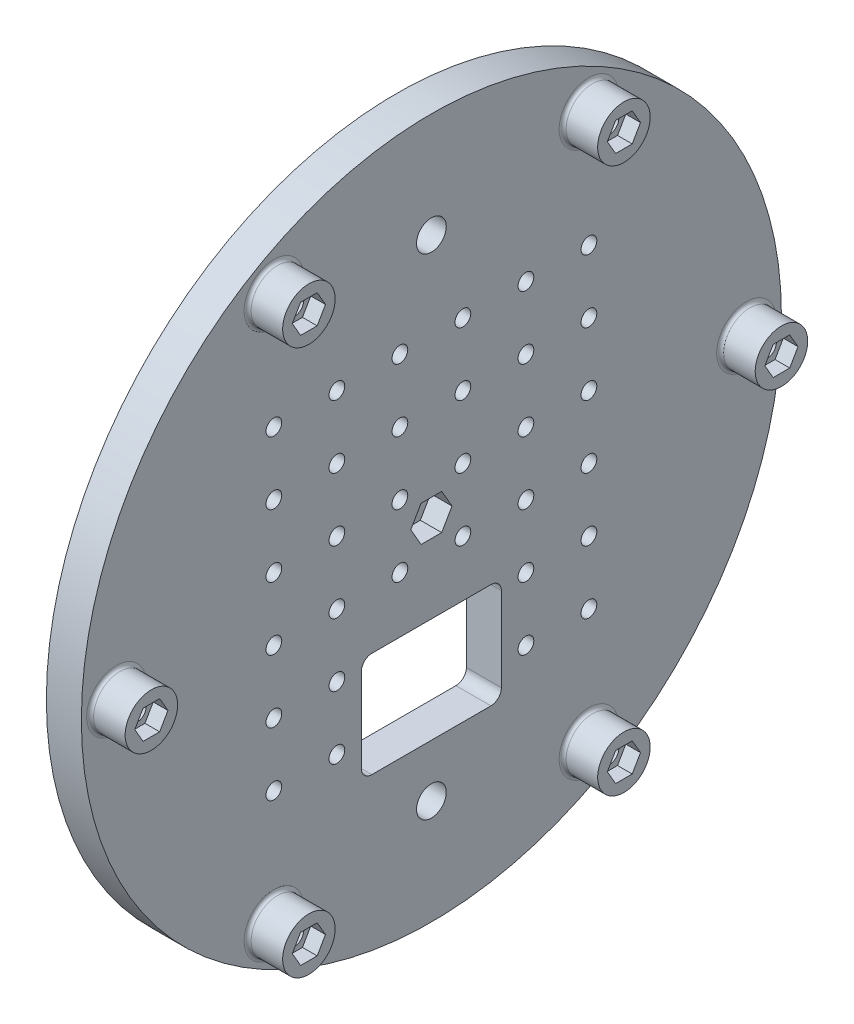
from build123d import *

# Parameters (mm, degrees)
SKETCH_1_R                       = 100
EXTRUDE_1_DEPTH                  = 10
SKETCH_2_R                       = 4.25
CUT_EXTRUDE_560_DEPTH            = 142.774468788
CUT_EXTRUDE_M6_DEPTH             = 6.1
CUT_EXTRUDE_M6_2_REACH           = 143.553
SKETCH_15_R                      = 3.15
CUT_EXTRUDE_3_REACH              = 143.774
SKETCH_17_R                      = 2.25
PATTERN_LINEAR_1_COUNT           = 6
PATTERN_LINEAR_1_PITCH           = 18
PATTERN_LINEAR_1_COUNT_DIR2      = 6
PATTERN_LINEAR_1_PITCH_DIR2      = 18
CUT_EXTRUDE_6901_REACH           = 143.774
WRAP_START                       = -0.3
WRAP_1_DEPTH                     = 0.3
SKETCH_25_R                      = 7.5
SKETCH_25_R_2                    = 2.75
EXTRUDE_3_DEPTH                  = 10
CUT_EXTRUDE_7_REACH              = 144.829
SKETCH_26_R                      = 2.75
FILLET_5_R                       = 1
CUT_EXTRUDE_8_DEPTH              = 4.2
PATTERN_CIRCULAR_3_COUNT         = 6
FILLET_5_OF_PATTERN_CIRCULAR_3_R = 1


# Read off the part's stored shape, not the designer's step: 包覆1
with BuildPart() as part:
    # 草圖1 → 填料-伸長1 (new body)
    with BuildSketch(Plane(origin=(0, 0, 0), x_dir=(0, 0, -1), z_dir=(1, 0, 0))):
        Circle(SKETCH_1_R)
    extrude(amount=EXTRUDE_1_DEPTH)

    # 草圖2 → Cut-Extrude 560 (cut, through all)
    with BuildSketch(Plane(origin=(10, 0, 0), x_dir=(0, 0, -1), z_dir=(1, 0, 0))):
        with Locations((0, 70)):
            Circle(SKETCH_2_R)
        with Locations(Location((0, -70, 0), (0, 0, 180))):
            Circle(SKETCH_2_R)
    extrude(amount=-CUT_EXTRUDE_560_DEPTH, mode=Mode.SUBTRACT)

    # 草圖14 → Cut-Extrude M6 (cut)
    with BuildSketch(Plane(origin=(10, 0, 0), x_dir=(0, 0, -1), z_dir=(1, 0, 0))):
        Polygon((5.888972746, 0), (2.944486373, 5.1), (-2.944486373, 5.1), (-5.888972746, 0), (-2.944486373, -5.1), (2.944486373, -5.1), align=None)
    extrude(amount=-CUT_EXTRUDE_M6_DEPTH, mode=Mode.SUBTRACT)

    # 草圖15 → Cut-Extrude M6 2 (cut, up to next)
    with BuildSketch(Plane(origin=(3.9, 0, 0), x_dir=(0, 0, -1), z_dir=(1, 0, 0)), mode=Mode.PRIVATE) as cut_extrude_m6_2_sk1:
        Circle(SKETCH_15_R)
    cut_extrude_m6_2_tool1 = extrude(cut_extrude_m6_2_sk1.sketch, amount=-CUT_EXTRUDE_M6_2_REACH, mode=Mode.PRIVATE) & part.part
    add(cut_extrude_m6_2_tool1.solids().sort_by_distance((3.9, 0, 0))[0], mode=Mode.SUBTRACT)

    # 草圖17 → 除料-伸長3 (cut, up to next)
    with BuildSketch(Plane(origin=(10, 0, 0), x_dir=(0, 0, -1), z_dir=(1, 0, 0)), mode=Mode.PRIVATE) as cut_extrude_3_sk1:
        with Locations((-45, 45)):
            Circle(SKETCH_17_R)
    cut_extrude_3_tool1 = extrude(cut_extrude_3_sk1.sketch, amount=-CUT_EXTRUDE_3_REACH, mode=Mode.PRIVATE) & part.part
    cut_extrude_3 = cut_extrude_3_tool1.solids().sort_by_distance((10, 45, 45))[0]
    add(cut_extrude_3, mode=Mode.SUBTRACT)

    # 直線複製排列1: Cut-Extrude 3 6 × 6, 4 skipped
    with Locations(*[(0, -i * PATTERN_LINEAR_1_PITCH, -j * PATTERN_LINEAR_1_PITCH_DIR2) for i in range(PATTERN_LINEAR_1_COUNT) for j in range(PATTERN_LINEAR_1_COUNT_DIR2) if (i, j) not in ((0, 0), (4, 2), (4, 3), (5, 2), (5, 3))]):
        add(cut_extrude_3, mode=Mode.SUBTRACT)

    # 草圖16 → Cut-Extrude 6901 (cut, up to next)
    with BuildSketch(Plane(origin=(10, 0, 0), x_dir=(0, 0, -1), z_dir=(1, 0, 0)), mode=Mode.PRIVATE) as cut_extrude_6901_sk1:
        with BuildLine():
            Line((-17, -25), (17, -25))
            ThreePointArc((17, -25), (19.121320344, -25.878679656), (20, -28))
            Line((20, -28), (20, -52))
            ThreePointArc((20, -52), (19.121320344, -54.121320344), (17, -55))
            Line((17, -55), (-17, -55))
            ThreePointArc((-17, -55), (-19.121320344, -54.121320344), (-20, -52))
            Line((-20, -52), (-20, -28))
            ThreePointArc((-20, -28), (-19.121320344, -25.878679656), (-17, -25))
        make_face()
    cut_extrude_6901_tool1 = extrude(cut_extrude_6901_sk1.sketch, amount=-CUT_EXTRUDE_6901_REACH, mode=Mode.PRIVATE) & part.part
    add(cut_extrude_6901_tool1.solids().sort_by_distance((10, -40, 0))[0], mode=Mode.SUBTRACT)

    # 包覆1 outline → 包覆1 (cut)
    # profile 1 of 5: a face of its own
    with BuildSketch(Plane.ZY.offset(WRAP_START)):
        with BuildLine():
            add(Edge.make_bspline(
                [(2.978342498, -64.338842147), (2.956105903, -64.378285479), (2.912842294, -64.455026582), (2.838441546, -64.560458442), (2.760449474, -64.655306158), (2.675345506, -64.737035812), (2.585675827, -64.808287197), (2.490943172, -64.870625022), (2.390654354, -64.923743542), (2.284804629, -64.96849607), (2.172505078, -65.002905564), (2.053483562, -65.027209785), (1.927512066, -65.042233054), (1.841165887, -65.043978194), (1.796952273, -65.044871795)],
                knots=[0, 0, 0, 0, 0.093369857, 0.181660766, 0.265874227, 0.346354784, 0.424599862, 0.501903184, 0.579992091, 0.658443431, 0.738672236, 0.821894148, 0.908800792, 1, 1, 1, 1], degree=3))
            Line((2.978342498, -64.338842147), (2.699296023, -64.192307692))
            add(Edge.make_bspline(
                [(1.757689453, -64.730769231), (1.789040601, -64.730161174), (1.851247291, -64.728954673), (1.943888149, -64.717222762), (2.035027676, -64.698252487), (2.124288659, -64.672362496), (2.209859505, -64.640785644), (2.289105055, -64.602682787), (2.361985271, -64.56053304), (2.430102238, -64.512323365), (2.496173231, -64.453315178), (2.561715717, -64.379679457), (2.631992371, -64.292591929), (2.675981964, -64.227046263), (2.699296023, -64.192307692)],
                knots=[0, 0, 0, 0, 0.082592263, 0.163878894, 0.24565874, 0.327725695, 0.408609961, 0.485749086, 0.559169056, 0.630268476, 0.705306028, 0.792064966, 0.889796437, 1, 1, 1, 1], degree=3))
            add(Edge.make_bspline(
                [(0.824496344, -63.788461538), (0.82603595, -63.822162003), (0.829063524, -63.888432606), (0.843178667, -63.98540339), (0.865427441, -64.077776732), (0.896696504, -64.164859774), (0.934563349, -64.247789901), (0.980949066, -64.325951938), (1.03628862, -64.398989868), (1.098014319, -64.467557006), (1.166721415, -64.528617767), (1.239004162, -64.583269543), (1.315897727, -64.62907514), (1.39679581, -64.66625503), (1.481567595, -64.695361346), (1.570239791, -64.715229166), (1.662637907, -64.728536273), (1.725623641, -64.730015939), (1.757689453, -64.730769231)],
                knots=[0, 0, 0, 0, 0.068384615, 0.134475588, 0.198391058, 0.260753477, 0.321829223, 0.383037238, 0.444653123, 0.507398011, 0.569825238, 0.630777641, 0.690928687, 0.750945133, 0.811049477, 0.872330853, 0.935004094, 1, 1, 1, 1], degree=3))
            Line((0.824496344, -63.788461538), (3.112957882, -63.788461538))
            add(Edge.make_bspline(
                [(2.83461253, -62.900841346), (2.856739468, -62.931044928), (2.900846061, -62.991251046), (2.956093161, -63.089422203), (3.004050556, -63.192132798), (3.042383517, -63.301043095), (3.073423018, -63.414862675), (3.095879837, -63.53440522), (3.109049456, -63.659635131), (3.111638153, -63.744961686), (3.112957882, -63.788461538)],
                knots=[0, 0, 0, 0, 0.11852184, 0.236254763, 0.356174434, 0.477249655, 0.601539871, 0.729618382, 0.862158266, 1, 1, 1, 1], degree=3))
            add(Edge.make_bspline(
                [(1.804664613, -62.397435897), (1.857112218, -62.398789946), (1.960002464, -62.401446282), (2.110034585, -62.426072615), (2.251995302, -62.46512517), (2.385827806, -62.52027896), (2.511545667, -62.591438512), (2.628331717, -62.679580353), (2.738183229, -62.781998441), (2.802091808, -62.86076165), (2.83461253, -62.900841346)],
                knots=[0, 0, 0, 0, 0.132040234, 0.259032841, 0.381879824, 0.502258444, 0.62275219, 0.744742632, 0.870108927, 1, 1, 1, 1], degree=3))
            add(Edge.make_bspline(
                [(0.804864934, -62.874198718), (0.836572616, -62.836329848), (0.898983563, -62.761791697), (1.004539918, -62.663853372), (1.118840115, -62.581809596), (1.240451741, -62.51380246), (1.370788215, -62.462128813), (1.508097506, -62.423621231), (1.653943092, -62.40204322), (1.753648313, -62.398995386), (1.804664613, -62.397435897)],
                knots=[0, 0, 0, 0, 0.128835254, 0.253589335, 0.374643257, 0.495340042, 0.616324775, 0.739759335, 0.86684232, 1, 1, 1, 1], degree=3))
            add(Edge.make_bspline(
                [(0.51039378, -63.728165064), (0.511452921, -63.688870234), (0.513551999, -63.610993069), (0.526782787, -63.495727524), (0.55023108, -63.383699072), (0.582407404, -63.274814624), (0.62395865, -63.16925649), (0.674790869, -63.066960426), (0.734983247, -62.968035287), (0.781455921, -62.905632153), (0.804864934, -62.874198718)],
                knots=[0, 0, 0, 0, 0.128044808, 0.2537679, 0.377428427, 0.500550841, 0.623295883, 0.746578332, 0.872347541, 1, 1, 1, 1], degree=3))
            add(Edge.make_bspline(
                [(1.796952273, -65.044871795), (1.747810296, -65.04372462), (1.651948534, -65.041486813), (1.512408787, -65.022194348), (1.381029369, -64.99072199), (1.257817665, -64.946756448), (1.143075413, -64.889329124), (1.036574558, -64.819369642), (0.937755032, -64.737237388), (0.849730823, -64.642220944), (0.77048694, -64.540538987), (0.70056112, -64.434583102), (0.642103689, -64.324619878), (0.594551079, -64.211349354), (0.556146214, -64.09548546), (0.52937951, -63.975973993), (0.513949762, -63.853138408), (0.511585317, -63.770041073), (0.51039378, -63.728165064)],
                knots=[0, 0, 0, 0, 0.071578658, 0.139629225, 0.204796697, 0.268134963, 0.329813747, 0.391301398, 0.453433515, 0.51655169, 0.579631271, 0.641118921, 0.701294047, 0.760810336, 0.819931722, 0.878919575, 0.938982822, 1, 1, 1, 1], degree=3))
        make_face()
        with BuildLine():
            add(Edge.make_bspline(
                [(1.820790414, -62.711538462), (1.789440976, -62.712150133), (1.727469727, -62.713359279), (1.636168659, -62.724829408), (1.54848896, -62.743789253), (1.463783672, -62.76975421), (1.383162804, -62.804362812), (1.304968036, -62.844946039), (1.231187639, -62.894487623), (1.185046344, -62.932246478), (1.161735927, -62.951322115)],
                knots=[0, 0, 0, 0, 0.131091976, 0.259141276, 0.384161763, 0.505991952, 0.629098089, 0.750669123, 0.874038938, 1, 1, 1, 1], degree=3))
            add(Edge.make_bspline(
                [(2.798855318, -63.474358974), (2.787358694, -63.432696101), (2.765231392, -63.35250848), (2.718995028, -63.24146759), (2.666923487, -63.142779689), (2.605301756, -63.057200056), (2.53548303, -62.981196543), (2.454837847, -62.914777957), (2.364401954, -62.855360506), (2.264642813, -62.805208007), (2.159001028, -62.762518148), (2.048394836, -62.733893032), (1.935537048, -62.71428349), (1.859202762, -62.712457382), (1.820790414, -62.711538462)],
                knots=[0, 0, 0, 0, 0.096240125, 0.185231261, 0.267500523, 0.344400382, 0.419594869, 0.496890627, 0.576637919, 0.660267852, 0.745386615, 0.830040327, 0.914474212, 1, 1, 1, 1], degree=3))
            Line((2.798855318, -63.474358974), (0.857449068, -63.474358974))
            add(Edge.make_bspline(
                [(1.161735927, -62.951322115), (1.145042645, -62.966416431), (1.111259511, -62.996963647), (1.06611899, -63.049592854), (1.022898517, -63.106344416), (0.983564864, -63.16938954), (0.947487278, -63.238010319), (0.913727301, -63.311627955), (0.883340888, -63.390801085), (0.866244778, -63.445973524), (0.857449068, -63.474358974)],
                knots=[0, 0, 0, 0, 0.109983845, 0.222580497, 0.338499871, 0.458708565, 0.585535346, 0.717517743, 0.85466682, 1, 1, 1, 1], degree=3))
        make_face(mode=Mode.SUBTRACT)
    # profile 2 of 5: a face of its own
    with BuildSketch(Plane.ZY.offset(WRAP_START)):
        with BuildLine():
            add(Edge.make_bspline(
                [(-0.286080579, -62.980769231), (-0.304471083, -62.959456084), (-0.339925808, -62.918366847), (-0.396157289, -62.863429781), (-0.452180893, -62.817292842), (-0.507229707, -62.778340583), (-0.562687976, -62.748891436), (-0.617904894, -62.727396574), (-0.672937632, -62.714094769), (-0.709723668, -62.71238033), (-0.72778731, -62.711538462)],
                knots=[0, 0, 0, 0, 0.158223098, 0.305035505, 0.441308964, 0.565963227, 0.683525114, 0.79333413, 0.898517512, 1, 1, 1, 1], degree=3))
            Line((-0.286080579, -62.980769231), (-0.072939553, -62.761318109))
            add(Edge.make_bspline(
                [(-0.72778731, -62.397435897), (-0.700595246, -62.398540238), (-0.645701025, -62.400769636), (-0.563346399, -62.418475326), (-0.481113056, -62.447608431), (-0.398789707, -62.487844664), (-0.316979417, -62.53991154), (-0.23496256, -62.602840839), (-0.15175453, -62.676218554), (-0.099798217, -62.732317779), (-0.072939553, -62.761318109)],
                knots=[0, 0, 0, 0, 0.105714261, 0.213411613, 0.32612673, 0.444451672, 0.56906108, 0.702712204, 0.846317947, 1, 1, 1, 1], degree=3))
            add(Edge.make_bspline(
                [(-1.374221605, -63.068409455), (-1.373687409, -63.044784057), (-1.372641914, -62.998545806), (-1.364297862, -62.930606986), (-1.349106151, -62.866058832), (-1.330051228, -62.803931969), (-1.303568224, -62.745429875), (-1.271922319, -62.689772404), (-1.234734894, -62.637036486), (-1.191891603, -62.588033354), (-1.144784958, -62.543524028), (-1.093890188, -62.5047254), (-1.040351931, -62.471619045), (-0.983943512, -62.443853884), (-0.924123039, -62.422852502), (-0.861308652, -62.408395117), (-0.795627497, -62.398739914), (-0.750726372, -62.397876829), (-0.72778731, -62.397435897)],
                knots=[0, 0, 0, 0, 0.06797849, 0.133043535, 0.196507438, 0.258613417, 0.319728338, 0.380872854, 0.442635602, 0.505079304, 0.56788052, 0.628813854, 0.688910091, 0.748765006, 0.809385783, 0.870884336, 0.934037463, 1, 1, 1, 1], degree=3))
            add(Edge.make_bspline(
                [(-1.257134265, -63.462439904), (-1.275264865, -63.433294289), (-1.3115324, -63.374992874), (-1.346747591, -63.277682397), (-1.37095362, -63.175237339), (-1.37311601, -63.104550485), (-1.374221605, -63.068409455)],
                knots=[0, 0, 0, 0, 0.246252371, 0.492590796, 0.740569991, 1, 1, 1, 1], degree=3))
            add(Edge.make_bspline(
                [(-0.816128656, -63.811598558), (-0.842175296, -63.797059426), (-0.892688044, -63.76886341), (-0.964235335, -63.724947329), (-1.028782689, -63.680280055), (-1.087883263, -63.637367216), (-1.140044269, -63.593946272), (-1.185060217, -63.54996902), (-1.224703433, -63.507209034), (-1.246650845, -63.476911737), (-1.257134265, -63.462439904)],
                knots=[0, 0, 0, 0, 0.157761664, 0.305950213, 0.443775499, 0.572824362, 0.692154156, 0.802295707, 0.905564392, 1, 1, 1, 1], degree=3))
            add(Edge.make_bspline(
                [(-0.428408303, -64.075220353), (-0.436430698, -64.06618499), (-0.45390637, -64.046502708), (-0.485961612, -64.01807763), (-0.524343474, -63.98743953), (-0.569483637, -63.955107941), (-0.621473099, -63.921509336), (-0.680522574, -63.886819984), (-0.745823127, -63.849392258), (-0.791993758, -63.824572603), (-0.816128656, -63.811598558)],
                knots=[0, 0, 0, 0, 0.076875074, 0.167461676, 0.272270023, 0.389550841, 0.520801368, 0.666263293, 0.825544915, 1, 1, 1, 1], degree=3))
            add(Edge.make_bspline(
                [(-0.342170323, -64.319210737), (-0.343256617, -64.296901119), (-0.34540136, -64.252853763), (-0.362244632, -64.189103422), (-0.388857484, -64.128634141), (-0.415062132, -64.093244494), (-0.428408303, -64.075220353)],
                knots=[0, 0, 0, 0, 0.253475435, 0.500453315, 0.745578135, 1, 1, 1, 1], degree=3))
            add(Edge.make_bspline(
                [(-0.793692759, -64.730769231), (-0.763374833, -64.729398406), (-0.704138691, -64.726720044), (-0.619294932, -64.702402952), (-0.540956306, -64.664273), (-0.47293296, -64.610188302), (-0.415030799, -64.547232729), (-0.373102625, -64.47631861), (-0.34682645, -64.399527153), (-0.343740451, -64.346294851), (-0.342170323, -64.319210737)],
                knots=[0, 0, 0, 0, 0.134042046, 0.261895674, 0.387836045, 0.517686206, 0.644508654, 0.764718263, 0.880290782, 1, 1, 1, 1], degree=3))
            add(Edge.make_bspline(
                [(-1.300603816, -64.461538462), (-1.280831403, -64.482893226), (-1.242499591, -64.524292666), (-1.181198374, -64.579417007), (-1.118818973, -64.625618278), (-1.055984287, -64.664261693), (-0.991764192, -64.694037096), (-0.926518578, -64.71495569), (-0.860380154, -64.728399882), (-0.815958018, -64.729978164), (-0.793692759, -64.730769231)],
                knots=[0, 0, 0, 0, 0.147475818, 0.285904172, 0.417171648, 0.540500744, 0.659237718, 0.775006098, 0.887228573, 1, 1, 1, 1], degree=3))
            Line((-1.300603816, -64.461538462), (-1.508836989, -64.698517628))
            add(Edge.make_bspline(
                [(-0.777566957, -65.044871795), (-0.812934133, -65.043879095), (-0.88317706, -65.041907487), (-0.987066779, -65.023401426), (-1.088587538, -64.994606032), (-1.186971078, -64.954890098), (-1.280017192, -64.904739385), (-1.365148116, -64.844676992), (-1.442659579, -64.776686994), (-1.486777853, -64.724574084), (-1.508836989, -64.698517628)],
                knots=[0, 0, 0, 0, 0.126742519, 0.251723961, 0.377218688, 0.504693549, 0.631458239, 0.755401067, 0.877700534, 1, 1, 1, 1], degree=3))
            add(Edge.make_bspline(
                [(-0.028067759, -64.305889423), (-0.028787292, -64.331158569), (-0.030205212, -64.380954182), (-0.040063279, -64.454289012), (-0.057018256, -64.52442357), (-0.08011201, -64.592118854), (-0.111296383, -64.656077794), (-0.14784418, -64.717914043), (-0.191719091, -64.776289974), (-0.241810467, -64.831128934), (-0.296655961, -64.881214681), (-0.355162099, -64.925238635), (-0.41740093, -64.961812972), (-0.482927731, -64.992078318), (-0.551891385, -65.016146576), (-0.624302675, -65.032809107), (-0.699931429, -65.042781868), (-0.751361237, -65.044166344), (-0.777566957, -65.044871795)],
                knots=[0, 0, 0, 0, 0.064548126, 0.127199133, 0.188597338, 0.248639515, 0.309524699, 0.370036991, 0.431889244, 0.495704286, 0.559519328, 0.62137158, 0.682397107, 0.743568482, 0.805498484, 0.868639701, 0.933066225, 1, 1, 1, 1], degree=3))
            add(Edge.make_bspline(
                [(-0.147258464, -63.910456731), (-0.129047936, -63.940122819), (-0.092805607, -63.99916384), (-0.054747341, -64.096382267), (-0.032687066, -64.19949277), (-0.029624845, -64.27002499), (-0.028067759, -64.305889423)],
                knots=[0, 0, 0, 0, 0.248838614, 0.495235025, 0.743335604, 1, 1, 1, 1], degree=3))
            add(Edge.make_bspline(
                [(-0.607895483, -63.551482372), (-0.580681906, -63.566727275), (-0.528114236, -63.596175407), (-0.453421469, -63.641885111), (-0.385634428, -63.687316535), (-0.32417876, -63.731983809), (-0.270236951, -63.777136676), (-0.222172398, -63.821044433), (-0.181183955, -63.865033742), (-0.158230028, -63.895766855), (-0.147258464, -63.910456731)],
                knots=[0, 0, 0, 0, 0.158989101, 0.307114592, 0.446213159, 0.574876072, 0.69415211, 0.80458118, 0.906593319, 1, 1, 1, 1], degree=3))
            add(Edge.make_bspline(
                [(-0.973179938, -63.287860577), (-0.965216444, -63.297645161), (-0.948267152, -63.318470416), (-0.916458637, -63.347374269), (-0.880436134, -63.37931652), (-0.837116196, -63.411253357), (-0.788365168, -63.444885082), (-0.733125884, -63.478887215), (-0.673151379, -63.51585164), (-0.630214072, -63.539296076), (-0.607895483, -63.551482372)],
                knots=[0, 0, 0, 0, 0.083425105, 0.177559821, 0.28398236, 0.402216747, 0.53356848, 0.676120994, 0.831649373, 1, 1, 1, 1], degree=3))
            add(Edge.make_bspline(
                [(-1.060119041, -63.055789263), (-1.059008228, -63.076001307), (-1.056789735, -63.116368418), (-1.039543056, -63.175916452), (-1.012076984, -63.23397349), (-0.98640679, -63.269536396), (-0.973179938, -63.287860577)],
                knots=[0, 0, 0, 0, 0.240039931, 0.479403194, 0.731756739, 1, 1, 1, 1], degree=3))
            add(Edge.make_bspline(
                [(-0.72778731, -62.711538462), (-0.7499267, -62.712613335), (-0.793493886, -62.714728532), (-0.855919704, -62.735841963), (-0.913870329, -62.768250701), (-0.964027309, -62.814219285), (-1.006514989, -62.866983554), (-1.03752867, -62.925979878), (-1.056494654, -62.989427922), (-1.058899386, -63.03345778), (-1.060119041, -63.055789263)],
                knots=[0, 0, 0, 0, 0.124958493, 0.245900629, 0.36916603, 0.498510841, 0.628503866, 0.751028329, 0.873724174, 1, 1, 1, 1], degree=3))
        make_face()
    # profile 3 of 5: a face of its own
    with BuildSketch(Plane.ZY.offset(WRAP_START)):
        with BuildLine():
            add(Edge.make_bspline(
                [(-2.316529297, -64.557592147), (-2.351948088, -64.597631741), (-2.421068303, -64.675769512), (-2.536509421, -64.777851685), (-2.658877599, -64.862230007), (-2.78757892, -64.930379922), (-2.922497163, -64.981571979), (-3.063333251, -65.017958138), (-3.210144631, -65.041351973), (-3.310396986, -65.043687995), (-3.361200771, -65.044871795)],
                knots=[0, 0, 0, 0, 0.134298379, 0.262084975, 0.386269912, 0.507164597, 0.627300236, 0.748144942, 0.872370177, 1, 1, 1, 1], degree=3))
            Line((-2.316529297, -64.557592147), (-2.316529297, -65))
            Line((-2.316529297, -65), (-2.002426733, -65))
            Line((-2.002426733, -65), (-2.002426733, -62.442307692))
            Line((-2.002426733, -62.442307692), (-2.316529297, -62.442307692))
            Line((-2.316529297, -62.442307692), (-2.316529297, -62.915564904))
            add(Edge.make_bspline(
                [(-3.351385066, -62.397435897), (-3.299185207, -62.398873649), (-3.196823747, -62.401693012), (-3.047095738, -62.425155739), (-2.90545126, -62.464794206), (-2.770796908, -62.518711704), (-2.643616222, -62.590360433), (-2.525113238, -62.680740394), (-2.414047754, -62.789281581), (-2.349667463, -62.872652026), (-2.316529297, -62.915564904)],
                knots=[0, 0, 0, 0, 0.129862142, 0.254653531, 0.376014554, 0.495255252, 0.614797719, 0.738105554, 0.8651963, 1, 1, 1, 1], degree=3))
            add(Edge.make_bspline(
                [(-4.694734425, -63.714142628), (-4.693481454, -63.669678925), (-4.691004397, -63.581776581), (-4.672551177, -63.452497883), (-4.641520169, -63.327979623), (-4.597972321, -63.208622679), (-4.542130366, -63.094282629), (-4.474202279, -62.984878604), (-4.394183154, -62.880109207), (-4.301930747, -62.78243798), (-4.201995977, -62.692217366), (-4.095087246, -62.61380832), (-3.983863965, -62.546091471), (-3.866600954, -62.492437995), (-3.745033849, -62.449028891), (-3.618080404, -62.418995922), (-3.486268825, -62.401298601), (-3.396778333, -62.398735837), (-3.351385066, -62.397435897)],
                knots=[0, 0, 0, 0, 0.063774532, 0.12607881, 0.186904093, 0.247573935, 0.308003356, 0.369131898, 0.432033228, 0.496790794, 0.561610823, 0.624913866, 0.686726349, 0.748078833, 0.809582291, 0.871630743, 0.934885821, 1, 1, 1, 1], degree=3))
            add(Edge.make_bspline(
                [(-3.361200771, -65.044871795), (-3.406368725, -65.043645423), (-3.49544193, -65.041226962), (-3.626471007, -65.022464659), (-3.752563257, -64.992334037), (-3.873837829, -64.950433147), (-3.989509975, -64.894852326), (-4.100570072, -64.828311078), (-4.206442764, -64.749070248), (-4.305514303, -64.658482219), (-4.396746303, -64.560087232), (-4.476807576, -64.455141685), (-4.543560655, -64.344099381), (-4.599380736, -64.228366227), (-4.642377081, -64.107051308), (-4.672350715, -63.98057414), (-4.691091161, -63.849084266), (-4.693508622, -63.759544743), (-4.694734425, -63.714142628)],
                knots=[0, 0, 0, 0, 0.064619991, 0.127433484, 0.189004127, 0.249930071, 0.310668454, 0.372328961, 0.43493911, 0.499575544, 0.564191208, 0.626735217, 0.688109334, 0.749293607, 0.810330528, 0.87190117, 0.935045915, 1, 1, 1, 1], degree=3))
        make_face()
        with BuildLine():
            add(Edge.make_bspline(
                [(-4.380631861, -63.717648237), (-4.378766968, -63.761238344), (-4.375044491, -63.8482477), (-4.348293797, -63.977228277), (-4.303413923, -64.102882319), (-4.24217186, -64.224143313), (-4.165485236, -64.336727413), (-4.076596583, -64.438467536), (-3.974646302, -64.525957124), (-3.861718795, -64.599194697), (-3.741110824, -64.658357218), (-3.614276893, -64.699522858), (-3.483601255, -64.726100638), (-3.394748921, -64.729205115), (-3.349982823, -64.730769231)],
                knots=[0, 0, 0, 0, 0.081589349, 0.162858895, 0.245483689, 0.330807139, 0.416493374, 0.499893203, 0.583048156, 0.667157852, 0.751311929, 0.833784789, 0.916256489, 1, 1, 1, 1], degree=3))
            add(Edge.make_bspline(
                [(-3.347178336, -62.711538462), (-3.393092673, -62.713172099), (-3.483720273, -62.71639664), (-3.616764275, -62.741570135), (-3.74407769, -62.78345473), (-3.865023764, -62.840736631), (-3.97769198, -62.912765368), (-4.078385651, -62.999886751), (-4.167928353, -63.099723765), (-4.243236617, -63.211825875), (-4.304627114, -63.332003967), (-4.347794146, -63.457628405), (-4.376263393, -63.586433382), (-4.379171914, -63.673796068), (-4.380631861, -63.717648237)],
                knots=[0, 0, 0, 0, 0.085920517, 0.169593435, 0.252475515, 0.336244477, 0.419504521, 0.502035907, 0.584774648, 0.669846475, 0.754184866, 0.836658238, 0.918009726, 1, 1, 1, 1], degree=3))
            add(Edge.make_bspline(
                [(-2.316529297, -63.726762821), (-2.317488953, -63.69142499), (-2.319377861, -63.621868957), (-2.33380843, -63.519741439), (-2.356763357, -63.422007713), (-2.389109527, -63.328565024), (-2.431600811, -63.239930009), (-2.482848577, -63.155466248), (-2.543754027, -63.075613037), (-2.613336723, -63.001469966), (-2.689501926, -62.933843504), (-2.770096466, -62.873479263), (-2.856075213, -62.82389049), (-2.94599225, -62.782849219), (-3.040003584, -62.750190069), (-3.138874204, -62.728402375), (-3.241553191, -62.713442054), (-3.311599247, -62.712179673), (-3.347178336, -62.711538462)],
                knots=[0, 0, 0, 0, 0.0656338, 0.129188088, 0.191218683, 0.251912818, 0.312507474, 0.373494434, 0.4351516, 0.498741474, 0.562095217, 0.624186567, 0.685475718, 0.746096815, 0.807611636, 0.869966581, 0.933951019, 1, 1, 1, 1], degree=3))
            add(Edge.make_bspline(
                [(-3.349982823, -64.730769231), (-3.30453632, -64.729109267), (-3.214147733, -64.725807763), (-3.080709026, -64.700526498), (-2.951214063, -64.6587577), (-2.827426834, -64.600858573), (-2.712110703, -64.529101217), (-2.608612826, -64.445094126), (-2.521096857, -64.347390942), (-2.446904248, -64.240014489), (-2.388728831, -64.122302492), (-2.346352772, -63.996968302), (-2.321298866, -63.864007553), (-2.318141136, -63.773143626), (-2.316529297, -63.726762821)],
                knots=[0, 0, 0, 0, 0.084802388, 0.16866354, 0.252551924, 0.338239689, 0.423102661, 0.505556051, 0.586175656, 0.66713572, 0.74849918, 0.830452399, 0.913455706, 1, 1, 1, 1], degree=3))
        make_face(mode=Mode.SUBTRACT)
    # profile 4 of 5: a face of its own
    with BuildSketch(Plane.ZY.offset(WRAP_START)):
        with BuildLine():
            add(Edge.make_bspline(
                [(-6.6144059, -61.5), (-6.580977421, -61.50017575), (-6.516184711, -61.500516398), (-6.421965269, -61.50579953), (-6.333716459, -61.513003199), (-6.251412686, -61.524433292), (-6.175091984, -61.538225069), (-6.104524347, -61.554926885), (-6.039934174, -61.574953499), (-5.962821438, -61.60679978), (-5.874900777, -61.654122949), (-5.779702384, -61.724051514), (-5.698298145, -61.809583977), (-5.628111828, -61.906066632), (-5.572310708, -62.012202404), (-5.531941411, -62.125461593), (-5.506383536, -62.244383335), (-5.503755101, -62.326026513), (-5.502426733, -62.36728766)],
                knots=[0, 0, 0, 0, 0.062594097, 0.121322939, 0.176680142, 0.228365096, 0.276868446, 0.321879128, 0.364098625, 0.403355696, 0.477967948, 0.550535461, 0.623584457, 0.698174882, 0.77335367, 0.847281125, 0.92281834, 1, 1, 1, 1], degree=3))
            Line((-6.6144059, -61.5), (-7.297298528, -61.5))
            Line((-7.297298528, -61.5), (-7.297298528, -65))
            Line((-7.297298528, -65), (-6.350784105, -65))
            add(Edge.make_bspline(
                [(-5.233195964, -64.006510417), (-5.23417281, -64.040677289), (-5.236094782, -64.107901567), (-5.250274753, -64.206656701), (-5.27428386, -64.301031648), (-5.307355007, -64.391636831), (-5.350517321, -64.478296965), (-5.403045286, -64.561110229), (-5.465676849, -64.63924456), (-5.535739718, -64.713568183), (-5.615001864, -64.78039597), (-5.700517619, -64.839911677), (-5.793363939, -64.888857739), (-5.892015933, -64.929973761), (-5.997580249, -64.961380959), (-6.109582856, -64.983353533), (-6.227927158, -64.99815857), (-6.309136909, -64.999375775), (-6.350784105, -65)],
                knots=[0, 0, 0, 0, 0.061160277, 0.120334558, 0.178180255, 0.235235126, 0.292682961, 0.351186248, 0.41045661, 0.471719854, 0.533761203, 0.595739024, 0.657887515, 0.72129518, 0.786822515, 0.854686154, 0.925477986, 1, 1, 1, 1], degree=3))
            add(Edge.make_bspline(
                [(-5.906974009, -63.111879006), (-5.867213581, -63.127144005), (-5.791142034, -63.15634973), (-5.686456021, -63.207985194), (-5.596261176, -63.264147304), (-5.51986403, -63.325479154), (-5.454526375, -63.391587965), (-5.397473434, -63.463443079), (-5.34879206, -63.541981837), (-5.307079136, -63.626385373), (-5.27453038, -63.715791841), (-5.250154476, -63.809362617), (-5.236187026, -63.906762172), (-5.234199385, -63.973047552), (-5.233195964, -64.006510417)],
                knots=[0, 0, 0, 0, 0.106057493, 0.202914257, 0.290300165, 0.370222566, 0.446383721, 0.5213969, 0.598291083, 0.676142469, 0.7555287, 0.834887172, 0.916646049, 1, 1, 1, 1], degree=3))
            add(Edge.make_bspline(
                [(-5.502426733, -62.36728766), (-5.503519951, -62.405940216), (-5.505668229, -62.481896133), (-5.526210988, -62.592990242), (-5.558371657, -62.698741461), (-5.603076906, -62.798763846), (-5.661178902, -62.89079746), (-5.730037221, -62.975584726), (-5.813114023, -63.049535783), (-5.875357263, -63.090878685), (-5.906974009, -63.111879006)],
                knots=[0, 0, 0, 0, 0.130569107, 0.256580609, 0.380551617, 0.503622917, 0.625739323, 0.747548582, 0.871766119, 1, 1, 1, 1], degree=3))
        make_face()
        with BuildLine():
            add(Edge.make_bspline(
                [(-6.535880259, -64.641025641), (-6.503861333, -64.640641894), (-6.442149074, -64.639902271), (-6.353047844, -64.637487717), (-6.27046474, -64.631995441), (-6.194776604, -64.623349591), (-6.125166152, -64.613971142), (-6.062468449, -64.601359861), (-6.006175255, -64.586910901), (-5.940900948, -64.564576728), (-5.867397439, -64.529880257), (-5.788186583, -64.477566031), (-5.717760365, -64.415242723), (-5.657955106, -64.343111809), (-5.608942117, -64.264680482), (-5.573286662, -64.181535132), (-5.551295805, -64.095049605), (-5.548633636, -64.036082892), (-5.547298528, -64.006510417)],
                knots=[0, 0, 0, 0, 0.072502489, 0.139738989, 0.201795135, 0.259821934, 0.312205989, 0.360773434, 0.404540343, 0.443698099, 0.516840794, 0.587874336, 0.657965418, 0.728969389, 0.79930772, 0.866635778, 0.933116329, 1, 1, 1, 1], degree=3))
            Line((-6.535880259, -64.641025641), (-6.983195964, -64.641025641))
            Line((-6.983195964, -64.641025641), (-6.983195964, -63.33974359))
            Line((-6.983195964, -63.33974359), (-6.774962791, -63.33974359))
            add(Edge.make_bspline(
                [(-6.120115034, -63.381109776), (-6.13714413, -63.377654692), (-6.174066722, -63.370163357), (-6.234274303, -63.362255654), (-6.303010172, -63.355210594), (-6.380433049, -63.349999436), (-6.46664089, -63.344612893), (-6.561817809, -63.342518071), (-6.665575123, -63.340018811), (-6.737567496, -63.339837677), (-6.774962791, -63.33974359)],
                knots=[0, 0, 0, 0, 0.079306486, 0.171952819, 0.277056507, 0.394730576, 0.526177321, 0.671344767, 0.829285257, 1, 1, 1, 1], degree=3))
            add(Edge.make_bspline(
                [(-5.547298528, -64.006510417), (-5.547574632, -63.988017076), (-5.548122387, -63.951328694), (-5.556383002, -63.897412875), (-5.568396872, -63.845187002), (-5.583928306, -63.794509261), (-5.606547773, -63.746295885), (-5.632954318, -63.699593325), (-5.66391572, -63.654339846), (-5.712159885, -63.597127593), (-5.78233187, -63.53121058), (-5.882038645, -63.466673077), (-5.995410943, -63.41462527), (-6.077638436, -63.392525794), (-6.120115034, -63.381109776)],
                knots=[0, 0, 0, 0, 0.060287398, 0.119602355, 0.177503371, 0.235142664, 0.292132593, 0.350871209, 0.410097863, 0.470731522, 0.594828704, 0.722578824, 0.85669139, 1, 1, 1, 1], degree=3))
        make_face(mode=Mode.SUBTRACT)
        with BuildLine():
            add(Edge.make_bspline(
                [(-6.772158303, -62.980769231), (-6.741309508, -62.980369308), (-6.681703349, -62.979596575), (-6.595383452, -62.977383058), (-6.515258434, -62.971185015), (-6.441466601, -62.964988752), (-6.374124157, -62.954914165), (-6.313380296, -62.942922042), (-6.258281699, -62.930239137), (-6.194742153, -62.90866965), (-6.122669205, -62.876791975), (-6.0458361, -62.827320139), (-5.978101631, -62.768395785), (-5.920904443, -62.700404824), (-5.874092973, -62.625538638), (-5.841579258, -62.544991757), (-5.819531973, -62.460771625), (-5.817540442, -62.402953373), (-5.816529297, -62.373597756)],
                knots=[0, 0, 0, 0, 0.072301034, 0.139700332, 0.202288511, 0.260599533, 0.313190329, 0.361738933, 0.405706476, 0.445539985, 0.518831956, 0.58977824, 0.658867479, 0.728430478, 0.797282704, 0.864815377, 0.931363753, 1, 1, 1, 1], degree=3))
            Line((-6.772158303, -62.980769231), (-6.983195964, -62.980769231))
            Line((-6.983195964, -62.980769231), (-6.983195964, -61.858974359))
            Line((-6.983195964, -61.858974359), (-6.556913912, -61.858974359))
            add(Edge.make_bspline(
                [(-5.816529297, -62.373597756), (-5.817055477, -62.354171985), (-5.818087637, -62.316066213), (-5.82654094, -62.260516859), (-5.840908514, -62.208273106), (-5.859362807, -62.158618996), (-5.885151496, -62.113107146), (-5.915514959, -62.07016395), (-5.95220065, -62.031251831), (-5.993957962, -61.994882333), (-6.041966585, -61.962637805), (-6.096197877, -61.934397042), (-6.157385554, -61.911656265), (-6.224498409, -61.891740113), (-6.298569497, -61.877751819), (-6.37874405, -61.866098431), (-6.465678769, -61.860165689), (-6.525823872, -61.859380327), (-6.556913912, -61.858974359)],
                knots=[0, 0, 0, 0, 0.057003133, 0.111817869, 0.164402372, 0.215869805, 0.26684111, 0.317478963, 0.369902136, 0.423400449, 0.479718398, 0.539241497, 0.602430689, 0.671029546, 0.744484798, 0.823453971, 0.908740313, 1, 1, 1, 1], degree=3))
        make_face(mode=Mode.SUBTRACT)
    # profile 5 of 5: a face of its own
    with BuildSketch(Plane.ZY.offset(WRAP_START)):
        Polygon((4.593727113, -65), (4.907829677, -65), (4.907829677, -61.5), (4.260694261, -61.5), (4.055265575, -61.858974359), (4.593727113, -61.858974359), align=None)
    extrude(amount=WRAP_1_DEPTH, mode=Mode.SUBTRACT)

    # 草圖25 → 填料-伸長3 (add)
    # profile 1 of 2: a face of its own
    with BuildSketch(Plane(origin=(10, 0, 0), x_dir=(0, 0, -1), z_dir=(1, 0, 0))):
        with Locations((45, 77.942286341)):
            Circle(SKETCH_25_R)
        with Locations((45, 77.942286341)):
            Circle(SKETCH_25_R_2, mode=Mode.SUBTRACT)
    # profile 2 of 2: a face of its own
    with BuildSketch(Plane(origin=(10, 0, 0), x_dir=(0, 0, -1), z_dir=(1, 0, 0))):
        with Locations((45, 77.942286341)):
            Circle(SKETCH_25_R_2)
    extrude_3 = extrude(amount=EXTRUDE_3_DEPTH)

    # 草圖26 → 除料-伸長7 (cut, up to next)
    with BuildSketch(Plane(origin=(20, 0, 0), x_dir=(0, 0, -1), z_dir=(1, 0, 0)), mode=Mode.PRIVATE) as cut_extrude_7_sk1:
        with Locations((45, 77.942286341)):
            Circle(SKETCH_26_R)
    cut_extrude_7_tool1 = extrude(cut_extrude_7_sk1.sketch, amount=-CUT_EXTRUDE_7_REACH, mode=Mode.PRIVATE) & part.part
    cut_extrude_7 = cut_extrude_7_tool1.solids().sort_by_distance((20, 77.942286, -45))[0]
    add(cut_extrude_7, mode=Mode.SUBTRACT)

    # 圓角5
    fillet_5_edges = [part.edges().sort_by_distance(p)[0] for p in [
        (10, 77.942286341, -37.5),
    ]]
    fillet(fillet_5_edges, radius=FILLET_5_R)

    # 草圖27 → 除料-伸長8 (cut)
    with BuildSketch(Plane(origin=(20, 0, 0), x_dir=(0, 0, -1), z_dir=(1, 0, 0))):
        Polygon((49.734272207, 77.942286341), (47.367136104, 82.042286341), (42.632863896, 82.042286341), (40.265727793, 77.942286341), (42.632863896, 73.842286341), (47.367136104, 73.842286341), align=None)
    cut_extrude_8 = extrude(amount=-CUT_EXTRUDE_8_DEPTH, mode=Mode.SUBTRACT)

    # 環狀複製排列3: 填料-伸長3, 除料-伸長7, 除料-伸長8 ×6 about axis
    pattern_circular_3_axis = Axis((0, 0, 0), (1, 0, 0))
    add([extrude_3.rotate(pattern_circular_3_axis, i * 360 / PATTERN_CIRCULAR_3_COUNT) for i in range(1, PATTERN_CIRCULAR_3_COUNT)])
    add([cut_extrude_7.rotate(pattern_circular_3_axis, i * 360 / PATTERN_CIRCULAR_3_COUNT) for i in range(1, PATTERN_CIRCULAR_3_COUNT)], mode=Mode.SUBTRACT)
    add([cut_extrude_8.rotate(pattern_circular_3_axis, i * 360 / PATTERN_CIRCULAR_3_COUNT) for i in range(1, PATTERN_CIRCULAR_3_COUNT)], mode=Mode.SUBTRACT)

    # 圓角5 of 環狀複製排列3
    fillet_5_of_pattern_circular_3_edges = [part.edges().sort_by_distance(p)[0] for p in [
        (10, 71.447095812, 48.75),
        (10, -6.495190528, 86.25),
        (10, -77.942286341, 37.5),
        (10, -71.447095812, -48.75),
        (10, 6.495190528, -86.25),
    ]]
    fillet(fillet_5_of_pattern_circular_3_edges, radius=FILLET_5_OF_PATTERN_CIRCULAR_3_R)


solid = part.part
